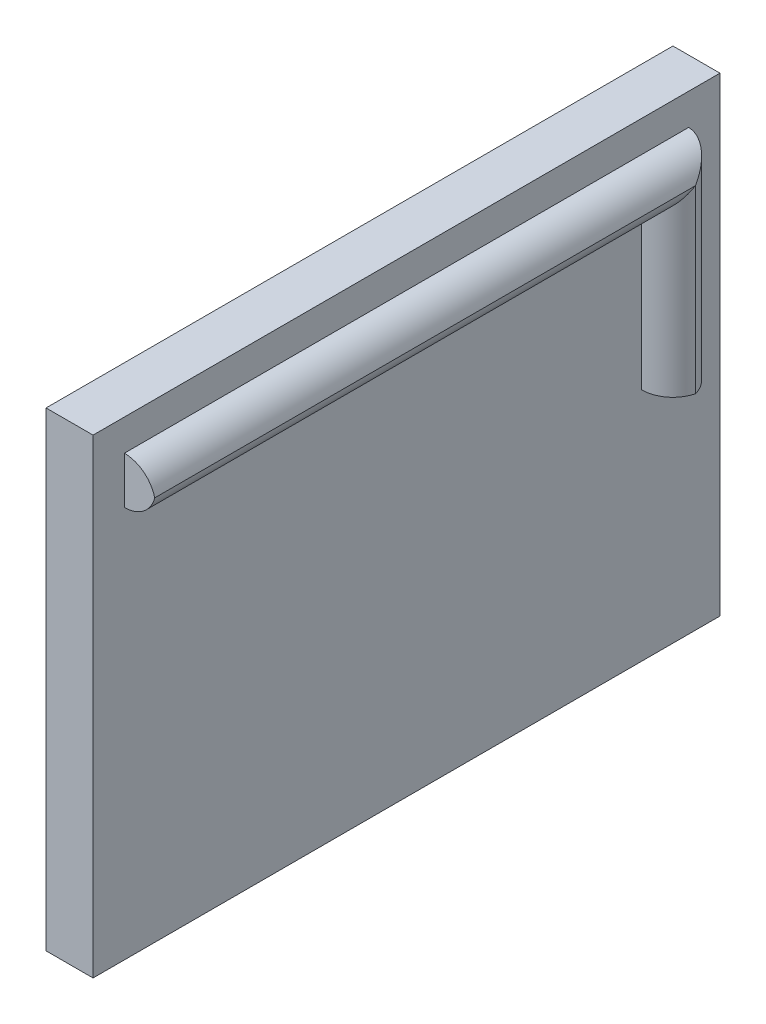
from build123d import *

# Parameters (mm, degrees)
SKETCH1_W           = 40
SKETCH1_H           = 30
BOSS_EXTRUDE1_DEPTH = 3
BOSS_EXTRUDE2_DEPTH = 2
FILLET1_R           = 2


with BuildPart() as part:
    # Sketch1 → Boss-Extrude1 (new body)
    with BuildSketch(Plane(origin=(0, 0, 0), x_dir=(0, 0, -1), z_dir=(1, 0, 0))):
        Rectangle(SKETCH1_W, SKETCH1_H)
    extrude(amount=BOSS_EXTRUDE1_DEPTH)

    # Sketch2 → Boss-Extrude2 (add)
    with BuildSketch(Plane(origin=(3, 0, 0), x_dir=(0, 0, -1), z_dir=(1, 0, 0))):
        Polygon((18, 0), (18, 13), (-13.768503326, 13), (-18, 13), (-18, 10), (-15, 10), (15, 10), (15, 0), align=None)
    extrude(amount=BOSS_EXTRUDE2_DEPTH)

    # Fillet1
    # the kernel refuses this fillet: 2 mm, written as the material it takes off along each edge
    with BuildSketch(Plane(origin=(5, 10, -15), x_dir=(-1, 0, 0), z_dir=(0, 0, 1))) as fillet1_piece_1:
        with BuildLine():
            CenterArc((FILLET1_R, -FILLET1_R), FILLET1_R, 90, 90)
            Line((0, -FILLET1_R), (0, 0))
            Line((0, 0), (FILLET1_R, 0))
        make_face()
    extrude(amount=38, mode=Mode.SUBTRACT)
    with BuildSketch(Plane(origin=(5, 13, 23), x_dir=(-1, 0, 0), z_dir=(0, 0, -1))) as fillet1_piece_2:
        with BuildLine():
            CenterArc((FILLET1_R, -FILLET1_R), FILLET1_R, 90, 90)
            Line((0, -FILLET1_R), (0, 0))
            Line((0, 0), (FILLET1_R, 0))
        make_face()
    extrude(amount=46, mode=Mode.SUBTRACT)
    with BuildSketch(Plane(origin=(5, 10, -15), x_dir=(-1, 0, 0), z_dir=(0, -1, 0))) as fillet1_piece_3:
        with BuildLine():
            CenterArc((FILLET1_R, FILLET1_R), FILLET1_R, 180, 90)
            Line((0, FILLET1_R), (0, 0))
            Line((0, 0), (FILLET1_R, 0))
        make_face()
    extrude(amount=15, mode=Mode.SUBTRACT)
    with BuildSketch(Plane(origin=(5, -5, -18), x_dir=(-1, 0, 0), z_dir=(0, 1, 0))) as fillet1_piece_4:
        with BuildLine():
            CenterArc((FILLET1_R, FILLET1_R), FILLET1_R, 180, 90)
            Line((0, FILLET1_R), (0, 0))
            Line((0, 0), (FILLET1_R, 0))
        make_face()
    extrude(amount=23, mode=Mode.SUBTRACT)
    with BuildSketch(Plane(origin=(5, 15, -15), x_dir=(-1, 0, 0), z_dir=(0, -1, 0))) as fillet1_piece_5a_section:
        with BuildLine():
            CenterArc((FILLET1_R, FILLET1_R), FILLET1_R, 180, 90)
            Line((0, FILLET1_R), (0, 0))
            Line((0, 0), (FILLET1_R, 0))
        make_face()
    fillet1_piece_5a = extrude(amount=20, mode=Mode.PRIVATE)
    fillet1_piece_5a = split(fillet1_piece_5a, bisect_by=Plane(origin=(4.547209771, 10, -15.452790229), z_dir=(0, 1, 0)), keep=Keep.TOP, mode=Mode.PRIVATE)
    with BuildSketch(Plane(origin=(5, 10, -20), x_dir=(-1, 0, 0), z_dir=(0, 0, 1))) as fillet1_piece_5b_section:
        with BuildLine():
            CenterArc((FILLET1_R, -FILLET1_R), FILLET1_R, 90, 90)
            Line((0, -FILLET1_R), (0, 0))
            Line((0, 0), (FILLET1_R, 0))
        make_face()
    fillet1_piece_5b = extrude(amount=43, mode=Mode.PRIVATE)
    fillet1_piece_5b = split(fillet1_piece_5b, bisect_by=Plane(origin=(4.547209771, 10.452790229, -15), z_dir=(0, 0, -1)), keep=Keep.TOP, mode=Mode.PRIVATE)
    fillet1_piece_5 = fillet1_piece_5a & fillet1_piece_5b
    add(fillet1_piece_5, mode=Mode.SUBTRACT)


solid = part.part
